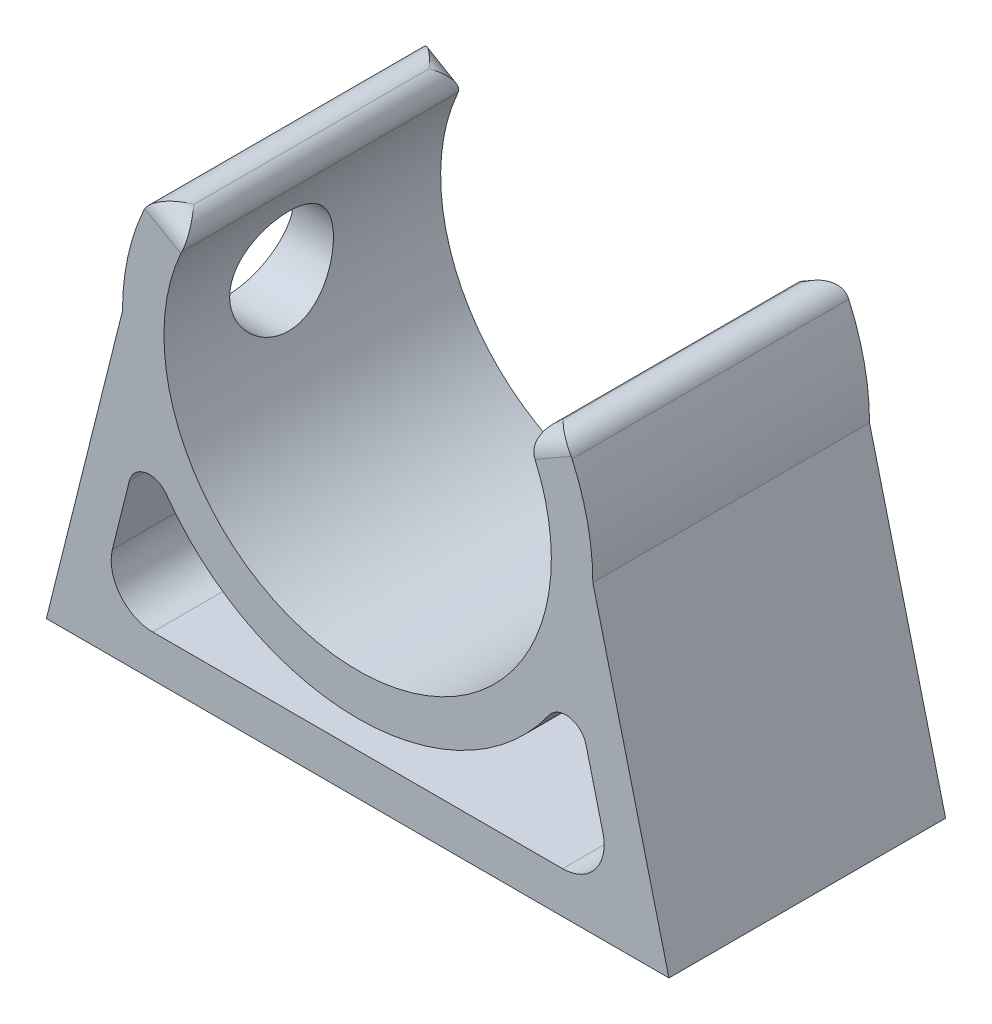
from build123d import *

# Parameters (mm, degrees)
BOSS_EXTRUDE1_DEPTH = 20
BOSS_EXTRUDE2_START = -20
BOSS_EXTRUDE2_DEPTH = 20
FILLET1_R           = 1.5
FILLET2_R           = 1.5
SKETCH3_R           = 3.75
CUT_EXTRUDE1_DEPTH  = 20


with BuildPart() as part:
    # Sketch1 → Boss-Extrude1 (new body)
    with BuildSketch(Plane.XY):
        with BuildLine():
            Line((12.14432037, 6.965305646), (14.746674735, 8.457871142))
            ThreePointArc((14.746674735, 8.457871142), (-0.048606097, -16.999930513), (-14.698068638, 8.542059371))
            Line((-14.698068638, 8.542059371), (-12.10429182, 7.034637129))
            ThreePointArc((-12.10429182, 7.034637129), (-0.04002855, -13.999942775), (12.14432037, 6.965305646))
        make_face()
    extrude(amount=BOSS_EXTRUDE1_DEPTH)

    # Sketch2 → Boss-Extrude2 (add)
    with BuildSketch(Plane.XY.offset(20).offset(BOSS_EXTRUDE2_START)):
        with BuildLine():
            Line((-17, 0), (-22.5, -22))
            Line((-22.5, -22), (22.5, -22))
            Line((22.5, -22), (17, 0))
            ThreePointArc((17, 0), (16.645771335, -3.452288612), (15.597847452, -6.760706684))
            Line((15.597847452, -6.760706684), (17.725769062, -15.272393125))
            ThreePointArc((17.725769062, -15.272393125), (17.179957876, -17.846236628), (14.815341562, -19))
            Line((14.815341562, -19), (-14.815341562, -19))
            ThreePointArc((-14.815341562, -19), (-17.179957876, -17.846236628), (-17.725769062, -15.272393125))
            Line((-17.725769062, -15.272393125), (-15.597847452, -6.760706684))
            ThreePointArc((-15.597847452, -6.760706684), (-16.645771335, -3.452288612), (-17, 0))
        make_face()
    extrude(amount=BOSS_EXTRUDE2_DEPTH)

    # Fillet1
    fillet1_edges = [part.edges().sort_by_distance(p)[0] for p in [
        (-15.597847452, -6.760706684, 10),
        (15.597847452, -6.760706684, 10),
    ]]
    fillet(fillet1_edges, radius=FILLET1_R)

    # Fillet2
    fillet2_edges = [part.edges().sort_by_distance(p)[0] for p in [
        (13.445497553, 7.711588394, 20),
        (13.445497553, 7.711588394, 0),
        (-13.401180229, 7.78834825, 0),
        (12.14432037, 6.965305646, 10),
        (14.746674735, 8.457871142, 10),
        (-14.698068638, 8.542059371, 10),
        (-12.10429182, 7.034637129, 10),
        (-13.401180229, 7.78834825, 20),
    ]]
    fillet(fillet2_edges, radius=FILLET2_R - 0.0001)  # a hair under: the kernel refuses the full size

    # Sketch3 → Cut-Extrude1 (cut)
    with BuildSketch(Plane(origin=(0, 0, 0), x_dir=(0, 0, -1), z_dir=(1, 0, 0))):
        with Locations((-11.5, 0)):
            Circle(SKETCH3_R)
    extrude(amount=-CUT_EXTRUDE1_DEPTH, mode=Mode.SUBTRACT)


solid = part.part
